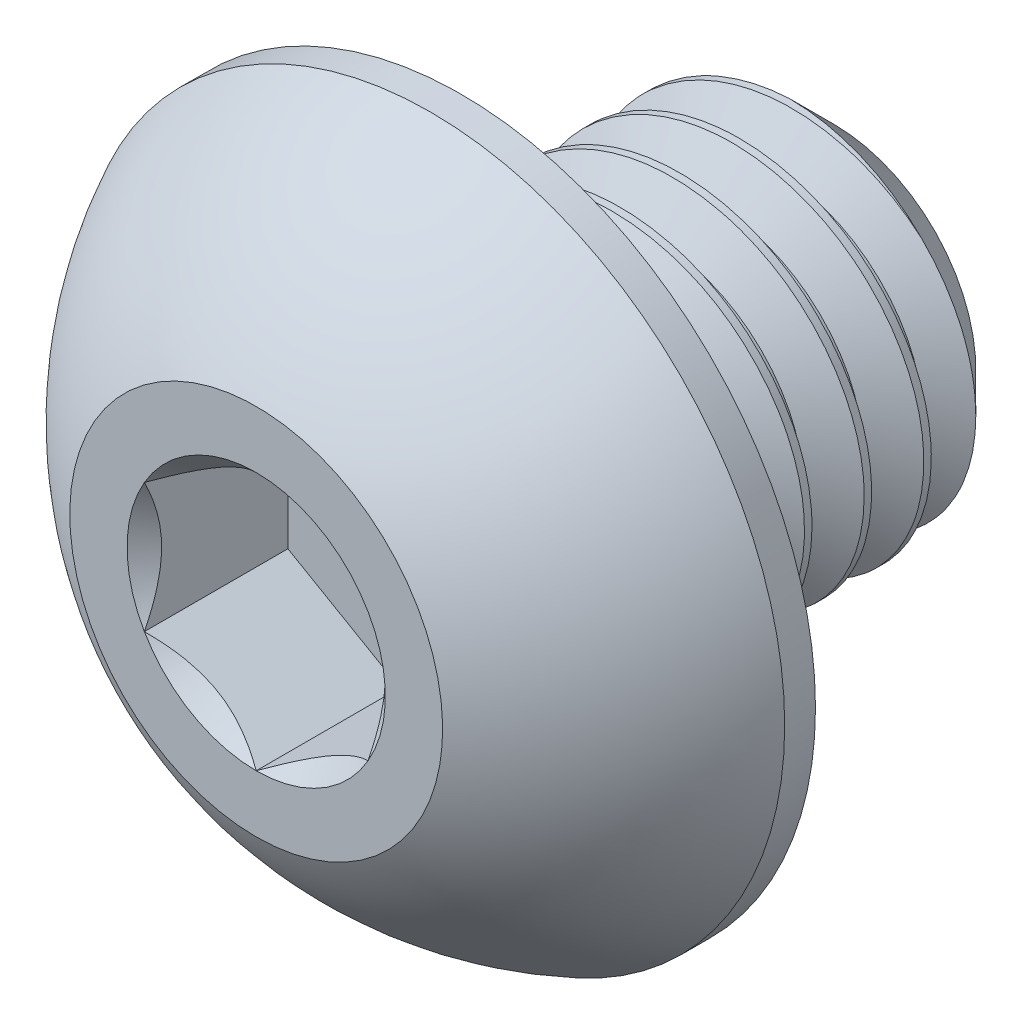
from build123d import *

# Parameters (mm, degrees)
SKETCH1_W          = 5
SKETCH1_H          = 2.5
CHAMFER1_SIZE      = 0.6
CUT_EXTRUDE2_DEPTH = 1.925
CUT_SWEEP1_PITCH   = 0.8


with BuildPart() as part:
    # Sketch1 → Revolve1 (revolve)
    with BuildSketch(Plane(origin=(0, 0, 0), x_dir=(0, 0, -1), z_dir=(1, 0, 0))):
        with Locations((5.25, 1.25)):
            Rectangle(SKETCH1_W, SKETCH1_H)
    revolve(axis=Axis((0, 0, -7.75), (0, 0, 1)))

    # Chamfer1
    chamfer1_edges = [part.edges().sort_by_distance(p)[0] for p in [
        (0, -2.5, -7.75),
    ]]
    chamfer(chamfer1_edges, length=CHAMFER1_SIZE)

    # Sketch7 → Revolve2 (revolve)
    with BuildSketch(Plane(origin=(0, 0, 0), x_dir=(0, 0, -1), z_dir=(1, 0, 0)), mode=Mode.PRIVATE) as revolve2_sk:
        with BuildLine():
            Line((2.3375, 4.75), (2.75, 4.75))
            Line((2.75, 4.75), (2.75, 0))
            Line((2.75, 0), (0, 0))
            Line((0, 0), (0, 2.5))
            ThreePointArc((0, 2.5), (0.991875183, 3.808753282), (2.3375, 4.75))
        make_face()
    revolve(revolve2_sk.sketch.rotate(Axis((0, 0, 0), (0, 0, -1)), 180), axis=Axis((0, 0, 0), (0, 0, -1)))

    # Sketch5 → Cut-Extrude2 (cut)
    with BuildSketch(Plane.XY):
        Polygon((1.5, -0.866025404), (1.5, 0.866025404), (0, 1.732050808), (-1.5, 0.866025404), (-1.5, -0.866025404), (0, -1.732050808), align=None)
    extrude(amount=-CUT_EXTRUDE2_DEPTH, mode=Mode.SUBTRACT)

    # Cut-Extrude3 cone 1 section (through the dimple's axis) → Cut-Extrude3 (revolve, cut)
    with BuildSketch(Plane(origin=(0, 0, 0), x_dir=(0, -1, 0), z_dir=(1, 0, 0))):
        Polygon((0, 0), (1.732050808, 0), (0, 1.732050808), align=None)
    revolve(axis=Axis((0, 0, 0), (0, 0, -1)), mode=Mode.SUBTRACT)

    # Cut-Sweep1: the profile of Sketch2 profile screwed along a right-hand helix of 7.25 turns, 8 arcs to a turn; built about Z, then put on its axis
    cut_sweep1_z = Axis((0, 0, 0), (0, 0, 1))
    cut_sweep1_corners = [(2.5003, 0, 0.600173205), (2.5003, 0, -0.100173205), (1.980384758, 0, 0.2), (1.980384758, 0, 0.3)]
    with BuildLine(mode=Mode.PRIVATE) as cut_sweep1_profile:
        Line(cut_sweep1_corners[0], cut_sweep1_corners[1])
        Line(cut_sweep1_corners[1], cut_sweep1_corners[2])
        Line(cut_sweep1_corners[2], cut_sweep1_corners[3])
        Line(cut_sweep1_corners[3], cut_sweep1_corners[0])
    cut_sweep1_cap = Face(cut_sweep1_profile.wire())
    cut_sweep1_turn_angles = [0, 22.5, 45, 67.5, 90, 112.5, 135, 157.5, 180, 202.5, 225, 247.5, 270, 292.5, 315, 337.5, 360]
    cut_sweep1_turn_weights = [1, 0.9238795325112867, 1, 0.9238795325112867, 1, 0.9238795325112867, 1, 0.9238795325112867, 1, 0.9238795325112867, 1, 0.9238795325112867, 1, 0.9238795325112867, 1, 0.9238795325112867, 1]
    cut_sweep1_turn_rails = [Edge.make_bspline([Vector(p[0], p[1], 0).rotate(cut_sweep1_z, cut_sweep1_turn_angles[k]) / cut_sweep1_turn_weights[k] + Vector(0, 0, p[2] + CUT_SWEEP1_PITCH * cut_sweep1_turn_angles[k] / 360) for k in range(17)], [0, 0, 0, 1, 1, 2, 2, 3, 3, 4, 4, 5, 5, 6, 6, 7, 7, 8, 8, 8], 2, cut_sweep1_turn_weights) for p in cut_sweep1_corners]
    cut_sweep1_turn_sides = [Face.make_surface_from_curves(cut_sweep1_turn_rails[p[0]], cut_sweep1_turn_rails[p[1]]) for p in [(0, 1), (1, 2), (2, 3), (3, 0)]]
    cut_sweep1_last_angles = [2520, 2542.5, 2565, 2587.5, 2610]
    cut_sweep1_last_weights = [1, 0.9238795325112867, 1, 0.9238795325112898, 1]
    cut_sweep1_last_rails = [Edge.make_bspline([Vector(p[0], p[1], 0).rotate(cut_sweep1_z, cut_sweep1_last_angles[k]) / cut_sweep1_last_weights[k] + Vector(0, 0, p[2] + CUT_SWEEP1_PITCH * cut_sweep1_last_angles[k] / 360) for k in range(5)], [0, 0, 0, 1, 1, 2, 2, 2], 2, cut_sweep1_last_weights) for p in cut_sweep1_corners]
    cut_sweep1_last_sides = [Face.make_surface_from_curves(cut_sweep1_last_rails[p[0]], cut_sweep1_last_rails[p[1]]) for p in [(0, 1), (1, 2), (2, 3), (3, 0)]]
    cut_sweep1 = Plane(origin=(0, 0, -7.75), x_dir=(0, 1, 0), z_dir=(0, 0, 1)) * Solid(Shell([*[p.moved(Location((0, 0, CUT_SWEEP1_PITCH * i))) for i in range(7) for p in cut_sweep1_turn_sides], *cut_sweep1_last_sides, cut_sweep1_cap, cut_sweep1_cap.rotate(cut_sweep1_z, 2610).moved(Location((0, 0, CUT_SWEEP1_PITCH * 2610 / 360)))]))
    add(cut_sweep1, mode=Mode.SUBTRACT)


solid = part.part
